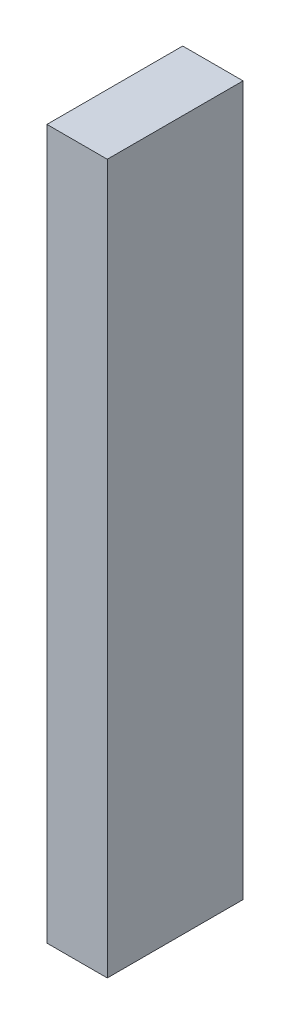
from build123d import *

# Parameters (mm, degrees)
SKETCH1_W           = 12.7
SKETCH1_H           = 149.225
BOSS_EXTRUDE1_DEPTH = 28.575
HOLE1_D             = 3.175
HOLE1_DEPTH         = 38.1
HOLE1_CSINK_D       = 10.16
HOLE1_CSINK_ANGLE   = 82
HOLE1_TIP           = 0.953866233


with BuildPart() as part:
    # Sketch1 → Boss-Extrude1 (new body)
    with BuildSketch(Plane.XY):
        with Locations((-120.138766336, -385.7625)):
            Rectangle(SKETCH1_W, SKETCH1_H)
    extrude(amount=BOSS_EXTRUDE1_DEPTH)

    # Hole1
    with Locations(Plane(origin=(0, 0, -25.4), x_dir=(-1, 0, 0), z_dir=(0, 0, -1))):
        with Locations((-75.688766336, -9.525), (218.563766336, -31.75), (218.563766336, -218.821), (218.563766336, -418.592), (104.263766336, -19.05), (104.263766336, -149.225), (104.263766336, -279.4), (120.138766336, -330.2), (120.138766336, -441.325), (-120.138766336, -441.325), (-120.138766336, -330.2), (-104.263766336, -279.4), (-104.263766336, -149.225), (-104.263766336, -19.05), (-218.563766336, -418.592), (-218.563766336, -218.821), (-218.563766336, -31.75), (0, -304.8), (107.438766336, -304.8), (-107.438766336, -304.8), (75.688766336, -276.225), (0, -276.225), (-75.688766336, -276.225), (75.688766336, -9.525), (0, -9.525)):
            CounterSinkHole(HOLE1_D / 2, HOLE1_CSINK_D / 2, depth=HOLE1_DEPTH, counter_sink_angle=HOLE1_CSINK_ANGLE)
            with Locations((0, 0, -(HOLE1_DEPTH + HOLE1_TIP / 2))):  # 118° drill point
                Cone(0, HOLE1_D / 2, HOLE1_TIP, mode=Mode.SUBTRACT)


solid = part.part
